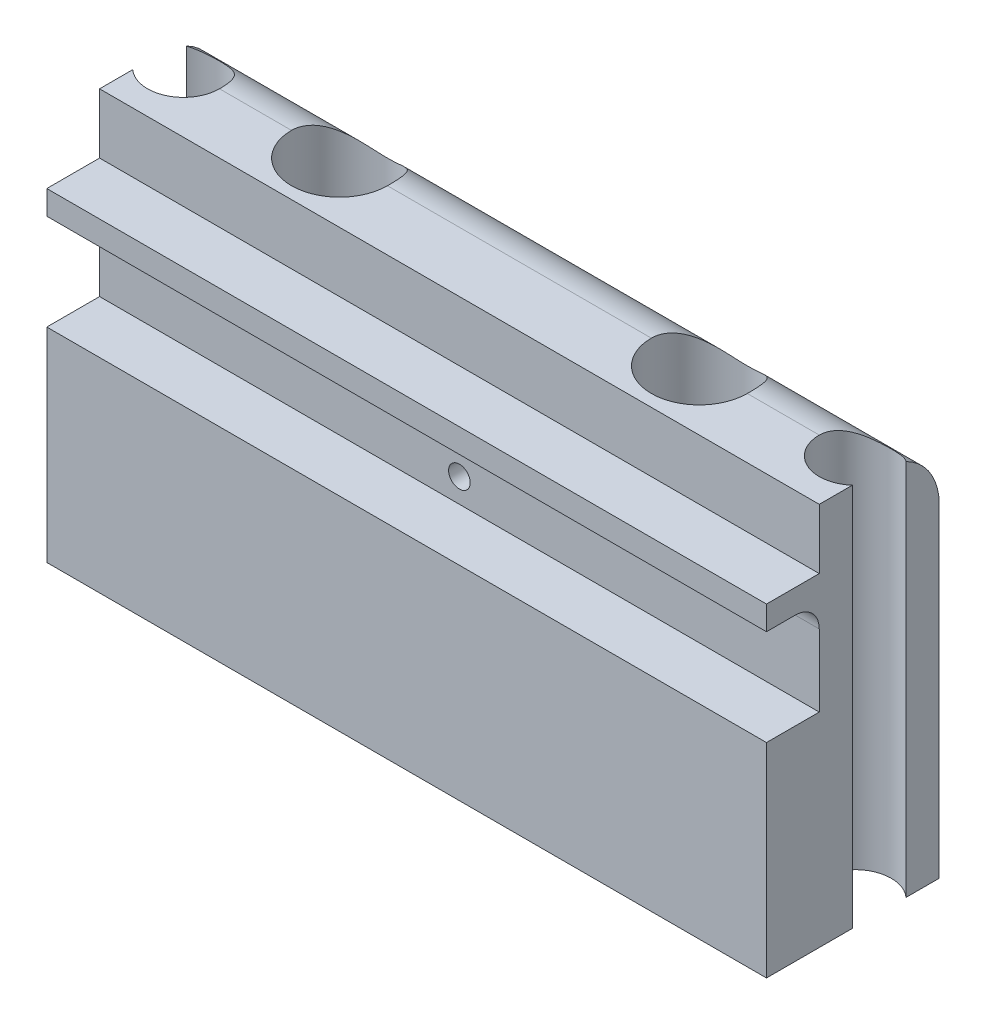
from build123d import *

# Parameters (mm, degrees)
SKETCH2_W           = 18.288
SKETCH2_H           = 40.64
BOSS_EXTRUDE1_DEPTH = 76.2
CUT_EXTRUDE1_REACH  = 90.275
SKETCH3_W           = 5.588
SKETCH3_H           = 6.35
SKETCH3_H_2         = 10.16
CUT_EXTRUDE2_REACH  = 89.289
SKETCH4_R           = 1.143
CUT_EXTRUDE3_REACH  = 90.275
SKETCH5_R           = 2.032
SKETCH6_R           = 5.08
CUT_EXTRUDE4_DEPTH  = 15.24
FILLET1_R           = 6.35
FILLET2_R           = 2.54
SKETCH7_R           = 3.81
CUT_EXTRUDE5_DEPTH  = 89.275141297


with BuildPart() as part:
    # Sketch2 → Boss-Extrude1 (new body)
    with BuildSketch(Plane(origin=(0, 0, 0), x_dir=(0, 0, -1), z_dir=(1, 0, 0))):
        with Locations((9.144, 20.32)):
            Rectangle(SKETCH2_W, SKETCH2_H)
    extrude(amount=BOSS_EXTRUDE1_DEPTH)

    # Sketch3 → Cut-Extrude1 (cut, up to next)
    with BuildSketch(Plane.ZY, mode=Mode.PRIVATE) as cut_extrude1_sk1:
        with Locations((-2.794, 37.465)):
            Rectangle(SKETCH3_W, SKETCH3_H)
    cut_extrude1_tool1 = extrude(cut_extrude1_sk1.sketch, amount=-CUT_EXTRUDE1_REACH, mode=Mode.PRIVATE) & part.part
    # Sketch3 → Cut-Extrude1 (cut, up to next)
    with BuildSketch(Plane.ZY, mode=Mode.PRIVATE) as cut_extrude1_sk2:
        with Locations((-2.794, 26.67)):
            Rectangle(SKETCH3_W, SKETCH3_H_2)
    cut_extrude1_tool2 = extrude(cut_extrude1_sk2.sketch, amount=-CUT_EXTRUDE1_REACH, mode=Mode.PRIVATE) & part.part
    add(cut_extrude1_tool1.solids().sort_by_distance((0, 37.465, -2.794))[0], mode=Mode.SUBTRACT)
    add(cut_extrude1_tool2.solids().sort_by_distance((0, 26.67, -2.794))[0], mode=Mode.SUBTRACT)

    # Sketch4 → Cut-Extrude2 (cut, up to next)
    with BuildSketch(Plane.XY.offset(-5.588), mode=Mode.PRIVATE) as cut_extrude2_sk1:
        with Locations((38.1, 24.13)):
            Circle(SKETCH4_R)
    cut_extrude2_tool1 = extrude(cut_extrude2_sk1.sketch, amount=-CUT_EXTRUDE2_REACH, mode=Mode.PRIVATE) & part.part
    add(cut_extrude2_tool1.solids().sort_by_distance((38.1, 24.13, -5.588))[0], mode=Mode.SUBTRACT)

    # Sketch5 → Cut-Extrude3 (cut, up to next)
    with BuildSketch(Plane(origin=(0, 40.64, 0), x_dir=(1, 0, 0), z_dir=(0, 1, 0)), mode=Mode.PRIVATE) as cut_extrude3_sk1:
        with Locations(Location((57.15, 11.938, 0), (0, 0, 270))):
            Circle(SKETCH5_R)
    cut_extrude3_tool1 = extrude(cut_extrude3_sk1.sketch, amount=-CUT_EXTRUDE3_REACH, mode=Mode.PRIVATE) & part.part
    # Sketch5 → Cut-Extrude3 (cut, up to next)
    with BuildSketch(Plane(origin=(0, 40.64, 0), x_dir=(1, 0, 0), z_dir=(0, 1, 0)), mode=Mode.PRIVATE) as cut_extrude3_sk2:
        with Locations(Location((19.05, 11.938, 0), (0, 0, 270))):
            Circle(SKETCH5_R)
    cut_extrude3_tool2 = extrude(cut_extrude3_sk2.sketch, amount=-CUT_EXTRUDE3_REACH, mode=Mode.PRIVATE) & part.part
    add(cut_extrude3_tool1.solids().sort_by_distance((57.15, 40.64, -11.938))[0], mode=Mode.SUBTRACT)
    add(cut_extrude3_tool2.solids().sort_by_distance((19.05, 40.64, -11.938))[0], mode=Mode.SUBTRACT)

    # Sketch6 → Cut-Extrude4 (cut)
    with BuildSketch(Plane(origin=(0, 40.64, 0), x_dir=(1, 0, 0), z_dir=(0, 1, 0))):
        with Locations(Location((19.05, 11.938, 0), (0, 0, 270))):
            Circle(SKETCH6_R)
        with Locations(Location((57.15, 11.938, 0), (0, 0, 270))):
            Circle(SKETCH6_R)
    extrude(amount=-CUT_EXTRUDE4_DEPTH, mode=Mode.SUBTRACT)

    # Fillet1
    # the kernel refuses this fillet: 6.35 mm, written as the material it takes off along each edge
    with BuildSketch(Plane(origin=(-15.875, 40.64, -18.288), x_dir=(0, -1, 0), z_dir=(1, 0, 0))) as fillet1_piece_1:
        with BuildLine():
            CenterArc((FILLET1_R, -FILLET1_R), FILLET1_R, 90, 90)
            Line((0, -FILLET1_R), (0, 0))
            Line((0, 0), (FILLET1_R, 0))
        make_face()
    extrude(amount=107.95, mode=Mode.SUBTRACT)

    # Fillet2
    fillet2_edges = [part.edges().sort_by_distance(p)[0] for p in [
        (38.1, 31.75, -5.588),
    ]]
    fillet(fillet2_edges, radius=FILLET2_R)

    # Sketch7 → Cut-Extrude5 (cut, through all)
    with BuildSketch(Plane.XZ):
        with Locations((2.54, -11.938)):
            Circle(SKETCH7_R)
        with Locations((73.66, -11.938)):
            Circle(SKETCH7_R)
    extrude(amount=-CUT_EXTRUDE5_DEPTH, mode=Mode.SUBTRACT)


solid = part.part
